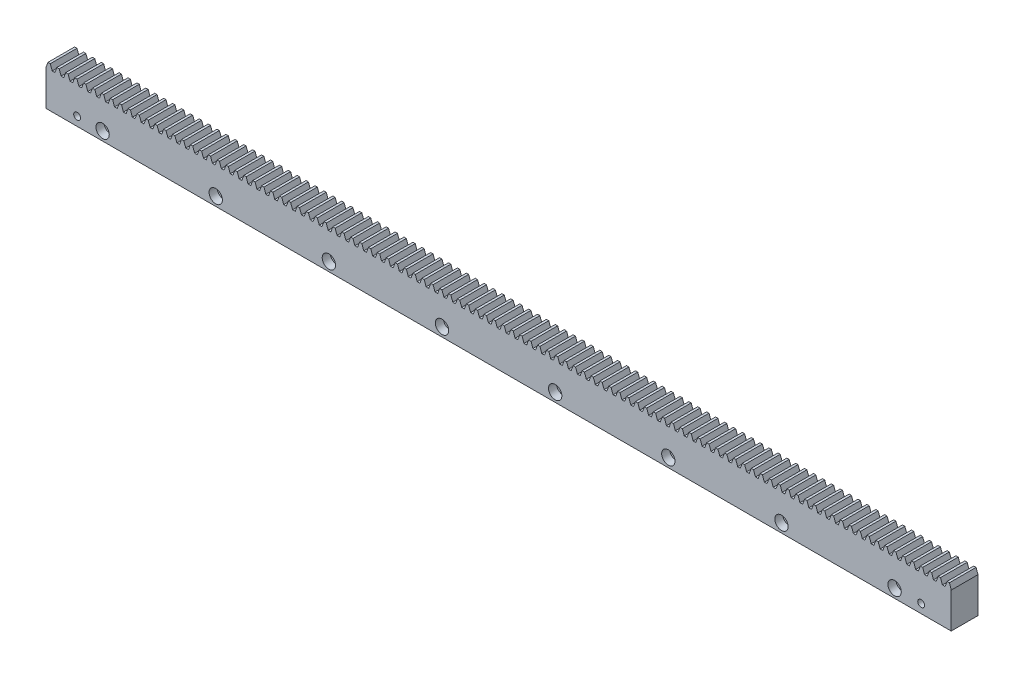
from build123d import *

# Parameters (mm, degrees)
SKETCH_1_W             = 1017.9
SKETCH_1_H             = 40
EXTRUDE_1_DEPTH        = 30
EXTRUDE_2_DEPTH        = 30
PATTERN_LINEAR_1_COUNT = 102
PATTERN_LINEAR_1_PITCH = 10.01
CUT_EXTRUDE_1_REACH    = 1021.49
SKETCH_3_R             = 3.85
PATTERN_LINEAR_2_COUNT = 2
PATTERN_LINEAR_2_PITCH = 949.1
SKETCH_4_R             = 7.5
CUT_EXTRUDE_2_DEPTH    = 9
CUT_EXTRUDE_3_REACH    = 1021.265
SKETCH_5_R             = 5
PATTERN_LINEAR_3_COUNT = 8
PATTERN_LINEAR_3_PITCH = 127.23


with BuildPart() as part:
    # 草图1 → 凸台-拉伸1 (new body)
    with BuildSketch(Plane.XY):
        with Locations((508.95, 20)):
            Rectangle(SKETCH_1_W, SKETCH_1_H)
    extrude(amount=EXTRUDE_1_DEPTH)

    # 草图2 → 凸台-拉伸2 (add)
    with BuildSketch(Plane.XY.offset(30)):
        Polygon((0, 40), (2.183821406, 46), (4.816178594, 46), (7, 40), align=None)
    extrude_2 = extrude(amount=-EXTRUDE_2_DEPTH)

    # 阵列(线性)1: 凸台-拉伸2 ×102
    with Locations(*[(i * PATTERN_LINEAR_1_PITCH, 0, 0) for i in range(1, PATTERN_LINEAR_1_COUNT)]):
        add(extrude_2)

    # 草图3 → 切除-拉伸1 (cut, up to next)
    with BuildSketch(Plane.XY.offset(30), mode=Mode.PRIVATE) as cut_extrude_1_sk1:
        with Locations((35, 10)):
            Circle(SKETCH_3_R)
    cut_extrude_1_tool1 = extrude(cut_extrude_1_sk1.sketch, amount=-CUT_EXTRUDE_1_REACH, mode=Mode.PRIVATE) & part.part
    cut_extrude_1 = cut_extrude_1_tool1.solids().sort_by_distance((35, 10, 30))[0]
    add(cut_extrude_1, mode=Mode.SUBTRACT)

    # 阵列(线性)2: 切除-拉伸1 ×2
    with Locations(*[(i * PATTERN_LINEAR_2_PITCH, 0, 0) for i in range(1, PATTERN_LINEAR_2_COUNT)]):
        add(cut_extrude_1, mode=Mode.SUBTRACT)

    # 草图4 → 切除-拉伸2 (cut)
    with BuildSketch(Plane.XY.offset(30)):
        with Locations((63.63, 10)):
            Circle(SKETCH_4_R)
    cut_extrude_2 = extrude(amount=-CUT_EXTRUDE_2_DEPTH, mode=Mode.SUBTRACT)

    # 草图5 → 切除-拉伸3 (cut, up to next)
    with BuildSketch(Plane.XY.offset(21), mode=Mode.PRIVATE) as cut_extrude_3_sk1:
        with Locations((63.63, 10)):
            Circle(SKETCH_5_R)
    cut_extrude_3_tool1 = extrude(cut_extrude_3_sk1.sketch, amount=-CUT_EXTRUDE_3_REACH, mode=Mode.PRIVATE) & part.part
    cut_extrude_3 = cut_extrude_3_tool1.solids().sort_by_distance((63.63, 10, 21))[0]
    add(cut_extrude_3, mode=Mode.SUBTRACT)

    # 阵列(线性)3: 切除-拉伸2, 切除-拉伸3 ×8
    with Locations(*[(i * PATTERN_LINEAR_3_PITCH, 0, 0) for i in range(1, PATTERN_LINEAR_3_COUNT)]):
        add(cut_extrude_2, mode=Mode.SUBTRACT)
        add(cut_extrude_3, mode=Mode.SUBTRACT)


solid = part.part
